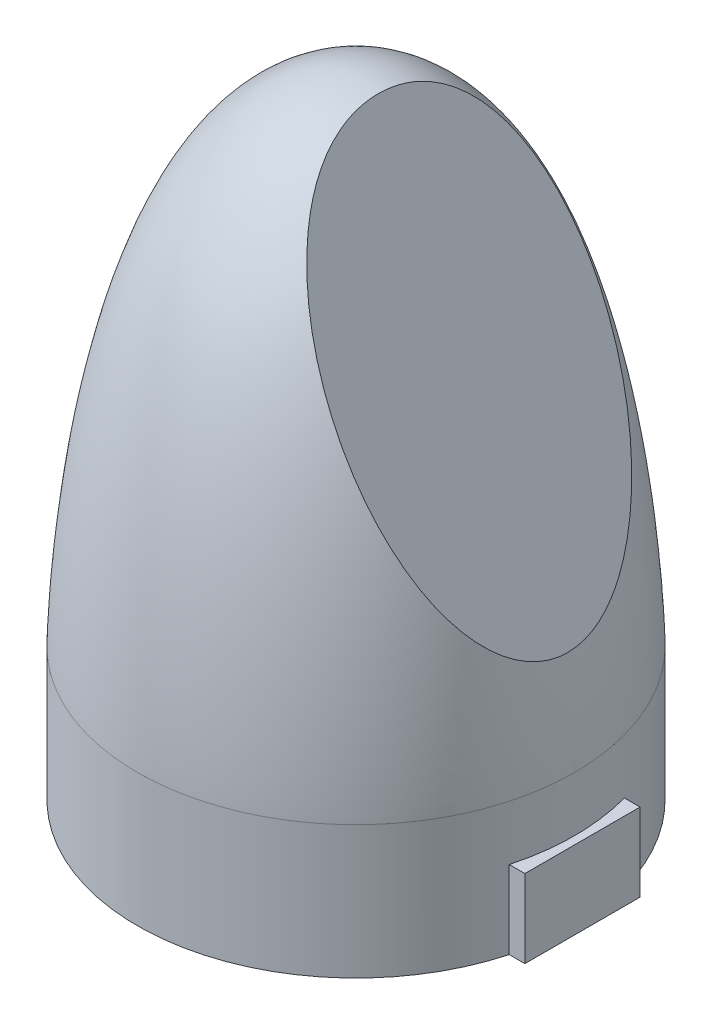
from build123d import *

# Parameters (mm, degrees)
SCALE2_SCALE           = 2
CUT_EXTRUDE1_START     = 15.280040905
CUT_EXTRUDE1_OUTLINE_W = 31
CUT_EXTRUDE1_OUTLINE_H = 20
CUT_EXTRUDE1_DEPTH     = 3.866864707
SKETCH3_W              = 4.189437374
SKETCH3_H              = 7.378412092
BOSS_EXTRUDE1_DEPTH    = 5


# Read off the part's stored shape, not the designer's step: Cut-Extrude1
with BuildPart() as part:
    # Sketch1 → Revolve1 (revolve)
    with BuildSketch(Plane.XY, mode=Mode.PRIVATE) as revolve1_sk:
        with BuildLine():
            Line((7, 4.256292026), (7, 0))
            Line((7, 0), (0, 0))
            Line((0, 0), (0, 20))
            add(Edge.make_bspline(
                [(0, 20), (6.748759859, 19.983290112), (7.005059619, 4.256663996), (7, 4.256292026)],
                knots=[0, 0, 0, 0, 0.166417438, 0.166417438, 0.166417438, 0.166417438], degree=3))
        make_face()
    revolve(revolve1_sk.sketch.rotate(Axis((0, 0, 0), (0, 1, 0)), 90), axis=Axis((0, 0, 0), (0, 1, 0)))


with BuildPart() as part_1:
    # Scale2: scaled about (0, 7.913014441, 0)
    add(part.part.scale(SCALE2_SCALE).moved(Location((0, -7.913014441, 0))))

    # Cut-Extrude1 outline → Cut-Extrude1 (cut)
    with BuildSketch(Plane(origin=(0, 0, 0), x_dir=(0.43801694528234036, -0.8989667155381935, 0), z_dir=(0.8989667155381934, 0.4380169452823407, 0)).offset(CUT_EXTRUDE1_START)):
        with Locations((-14.5, 0)):
            Rectangle(CUT_EXTRUDE1_OUTLINE_W, CUT_EXTRUDE1_OUTLINE_H)
    extrude(amount=CUT_EXTRUDE1_DEPTH, mode=Mode.SUBTRACT)

    # Sketch3 → Boss-Extrude1 (add)
    with BuildSketch(Plane(origin=(0, -7.913030029, 0), x_dir=(-1, 0, 0), z_dir=(0, -1, 0))):
        with Locations((-12.411989831, 0)):
            Rectangle(SKETCH3_W, SKETCH3_H)
    extrude(amount=-BOSS_EXTRUDE1_DEPTH)


solid = part_1.part
